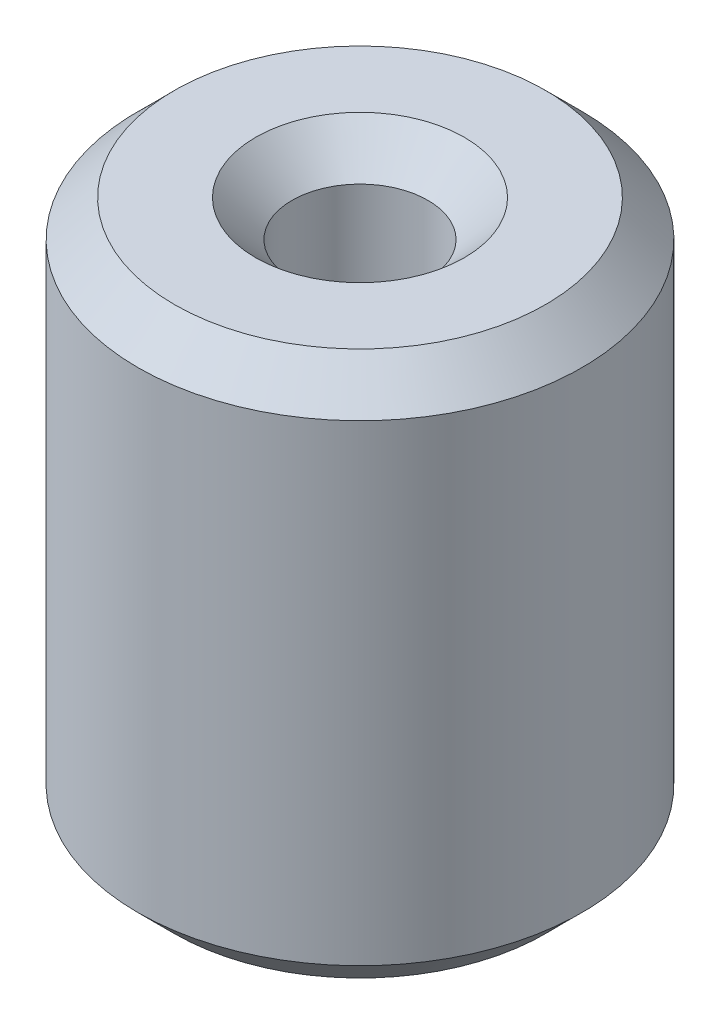
from build123d import *

# Parameters (mm, degrees)
SKETCH1_R           = 7.5
BOSS_EXTRUDE1_DEPTH = 18.408846789
SKETCH2_R           = 2.296187536
CUT_EXTRUDE1_DEPTH  = 22.245838183
CHAMFER1_SIZE       = 1.230149247


with BuildPart() as part:
    # Sketch1 → Boss-Extrude1 (new body)
    with BuildSketch(Plane(origin=(0, 0, 0), x_dir=(1, 0, 0), z_dir=(0, 1, 0))):
        Circle(SKETCH1_R)
    extrude(amount=BOSS_EXTRUDE1_DEPTH)

    # Sketch2 → Cut-Extrude1 (cut, through all)
    with BuildSketch(Plane(origin=(0, 0, 0), x_dir=(1, 0, 0), z_dir=(0, 1, 0))):
        Circle(SKETCH2_R)
    extrude(amount=CUT_EXTRUDE1_DEPTH, mode=Mode.SUBTRACT)

    # Chamfer1
    chamfer1_edges = [part.edges().sort_by_distance(p)[0] for p in [
        (-2.296187536, 18.408846789, 0),
        (-2.296187536, 0, 0),
        (-7.5, 0, 0),
        (-7.5, 18.408846789, 0),
    ]]
    chamfer(chamfer1_edges, length=CHAMFER1_SIZE)


solid = part.part
